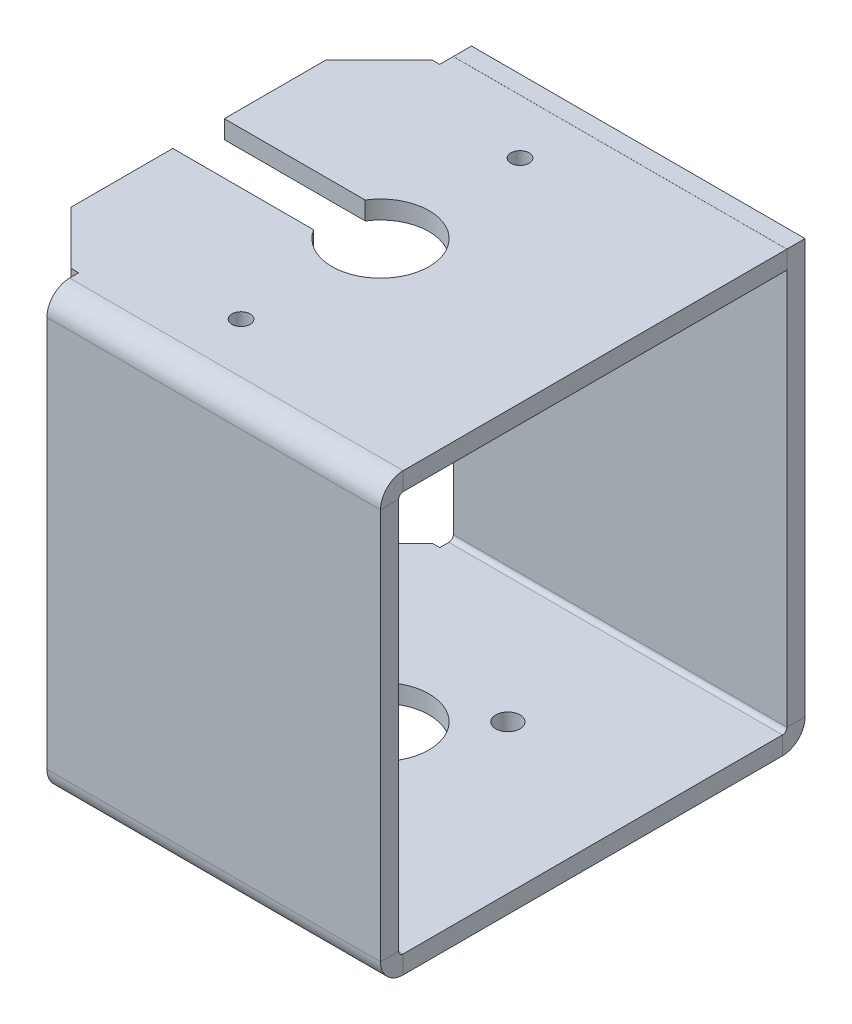
from build123d import *

# Parameters (mm, degrees)
BASE_FLANGE1_DEPTH           = 3
SKETCH7_R                    = 8
SKETCH7_R_2                  = 2
CUT_EXTRUDE1_DEPTH           = 3
EDGE_FLANGE1_START           = -27.5
EDGE_FLANGE1_DEPTH           = 55
EDGE_FLANGE1_START_2         = -28.7366
EDGE_FLANGE1_2_DEPTH         = 1.2366
EDGE_FLANGE1_3_DEPTH         = 55
EDGE_FLANGE2_STRIP_W         = 13.4732
EDGE_FLANGE2_STRIP_H         = 3
EDGE_FLANGE2_STRIP_CUT_DEPTH = 55
EDGE_FLANGE2_DEPTH           = 55
BOSS_EXTRUDE1_DEPTH          = 3
SKETCH18_R                   = 8
SKETCH18_R_2                 = 1.5
CUT_EXTRUDE2_DEPTH           = 3
SKETCH19_W                   = 24
SKETCH19_H                   = 8.5
CUT_EXTRUDE3_DEPTH           = 72


# Read off the part's stored shape, not the designer's step: Edge-Flange1
# Sheet-metal steps are written as plain solids
with BuildPart() as part:
    # Sketch1 → Base-Flange1 (new body)
    with BuildSketch(Plane(origin=(0, 0, 0), x_dir=(1, 0, 0), z_dir=(0, 1, 0))):
        Polygon((-37.5, 21), (-37.5, -21), (-27.5, -31), (-27.5, -35), (27.5, -35), (27.5, 35), (-27.5, 35), (-27.5, 31), align=None)
    extrude(amount=-BASE_FLANGE1_DEPTH)

    # Sketch7 → Cut-Extrude1 (cut)
    with BuildSketch(Plane(origin=(0, 0, 0), x_dir=(1, 0, 0), z_dir=(0, 1, 0))):
        with Locations(Location((-7.5, 0, 0), (0, 0, 270))):
            Circle(SKETCH7_R)
        with Locations(Location((-18, 10.5, 0), (0, 0, 270))):
            Circle(SKETCH7_R_2)
        with Locations(Location((3, 10.5, 0), (0, 0, 270))):
            Circle(SKETCH7_R_2)
        with Locations(Location((3, -10.5, 0), (0, 0, 270))):
            Circle(SKETCH7_R_2)
        with Locations(Location((-18, -10.5, 0), (0, 0, 270))):
            Circle(SKETCH7_R_2)
    extrude(amount=-CUT_EXTRUDE1_DEPTH, mode=Mode.SUBTRACT)

    # Edge-Flange1 outline → Edge-Flange1 (cut)
    with BuildSketch(Plane.YZ.offset(EDGE_FLANGE1_START)):
        with BuildLine():
            Line((-3, 35), (-3, 31.2634))
            ThreePointArc((-3, 31.2634), (-2.154295979, 33.630867001), (0, 34.926677222))
            Line((0, 34.926677222), (0, 35))
            Line((0, 35), (-3, 35))
        make_face()
        with BuildLine():
            ThreePointArc((0, -34.926677222), (-2.154295979, -33.630867001), (-3, -31.2634))
            Line((-3, -31.2634), (-3, -35))
            Line((-3, -35), (0, -35))
            Line((0, -35), (0, -34.926677222))
        make_face()
    extrude(amount=EDGE_FLANGE1_DEPTH, mode=Mode.SUBTRACT)

    # Edge-Flange1 2 outline → Edge-Flange1 2 (cut)
    with BuildSketch(Plane.YZ.offset(EDGE_FLANGE1_START_2)):
        with BuildLine():
            Line((-3, 29.7634), (0, 29.7634))
            Line((0, 29.7634), (0, 34.926677222))
            ThreePointArc((0, 34.926677222), (-2.154295979, 33.630867001), (-3, 31.2634))
            Line((-3, 31.2634), (-3, 29.7634))
        make_face()
        with BuildLine():
            Line((0, -34.926677222), (0, -29.7634))
            Line((0, -29.7634), (-3, -29.7634))
            Line((-3, -29.7634), (-3, -31.2634))
            ThreePointArc((-3, -31.2634), (-2.154295979, -33.630867001), (0, -34.926677222))
        make_face()
    extrude(amount=EDGE_FLANGE1_2_DEPTH, mode=Mode.SUBTRACT)

    # Edge-Flange1 3 outline → Edge-Flange1 3 (add)
    with BuildSketch(Plane.YZ.offset(EDGE_FLANGE1_START)):
        with BuildLine():
            Line((0, 34.926677222), (0, 31.2634))
            ThreePointArc((0, 31.2634), (0.215745145, 31.784254855), (0.7366, 32))
            Line((0.7366, 32), (69, 32))
            Line((69, 32), (69, 35))
            Line((69, 35), (0.7366, 35))
            ThreePointArc((0.7366, 35), (0.36647982, 34.981624121), (0, 34.926677222))
        make_face()
        with BuildLine():
            ThreePointArc((0.7366, -32), (0.215745145, -31.784254855), (0, -31.2634))
            Line((0, -31.2634), (0, -34.926677222))
            ThreePointArc((0, -34.926677222), (0.36647982, -34.981624121), (0.7366, -35))
            Line((0.7366, -35), (69, -35))
            Line((69, -35), (69, -32))
            Line((69, -32), (0.7366, -32))
        make_face()
    extrude(amount=EDGE_FLANGE1_3_DEPTH)

    # Edge-Flange2 strip (across the edge) → Edge-Flange2 strip cut (cut)
    with BuildSketch(Plane(origin=(-27.5, 69, 32), x_dir=(0, -1, 0), z_dir=(1, 0, 0))):
        with Locations((-3, -1.5)):
            Rectangle(EDGE_FLANGE2_STRIP_W, EDGE_FLANGE2_STRIP_H)
    extrude(amount=EDGE_FLANGE2_STRIP_CUT_DEPTH, mode=Mode.SUBTRACT)

    # Edge-Flange2 section (across the edge) → Edge-Flange2 (add)
    with BuildSketch(Plane(origin=(-27.5, 69, 32), x_dir=(0, -1, 0), z_dir=(1, 0, 0))):
        with BuildLine():
            Line((0, 0.7366), (0, 63.99))
            Line((0, 63.99), (3, 63.99))
            Line((3, 63.99), (3, 0.7366))
            ThreePointArc((3, 0.7366), (3.215745145, 0.215745145), (3.7366, 0))
            Line((3.7366, 0), (3.7366, -3))
            ThreePointArc((3.7366, -3), (1.094424801, -1.905575199), (0, 0.7366))
        make_face()
    extrude(amount=EDGE_FLANGE2_DEPTH)

    # Sketch17 → Boss-Extrude1 (add)
    with BuildSketch(Plane(origin=(0, 69, 0), x_dir=(1, 0, 0), z_dir=(0, 1, 0))):
        Polygon((-27.5, -29.7634), (-28.7366, -29.7634), (-37.5, -21), (-37.5, 21), (-28.7366, 29.7634), (-27.5, 29.7634), align=None)
    extrude(amount=-BOSS_EXTRUDE1_DEPTH)

    # Sketch18 → Cut-Extrude2 (cut)
    with BuildSketch(Plane(origin=(0, 69, 0), x_dir=(1, 0, 0), z_dir=(0, 1, 0))):
        with Locations(Location((-7.5, 0, 0), (0, 0, 270))):
            Circle(SKETCH18_R)
        with Locations(Location((-7.5, 23, 0), (0, 0, 270))):
            Circle(SKETCH18_R_2)
        with Locations(Location((-7.5, -23, 0), (0, 0, 270))):
            Circle(SKETCH18_R_2)
    extrude(amount=-CUT_EXTRUDE2_DEPTH, mode=Mode.SUBTRACT)

    # Sketch19 → Cut-Extrude3 (cut)
    with BuildSketch(Plane(origin=(0, 69, 0), x_dir=(1, 0, 0), z_dir=(0, 1, 0))):
        with Locations((-25.5, 0)):
            Rectangle(SKETCH19_W, SKETCH19_H)
    extrude(amount=-CUT_EXTRUDE3_DEPTH, mode=Mode.SUBTRACT)


solid = part.part
